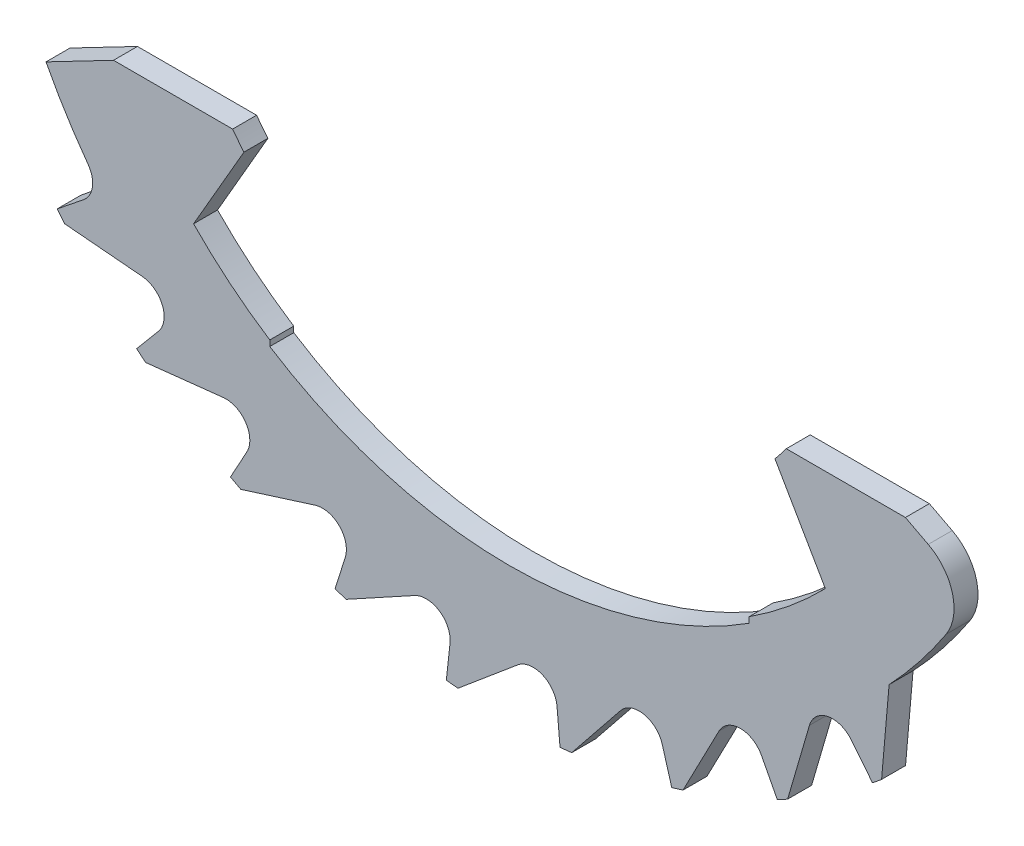
from build123d import *

# Parameters (mm, degrees)
OTHER_10076_5_DEPTH = 0.5
CUT_EXTRUDE1_REACH  = 18.147


# Read off the part's stored shape, not the designer's step: 10076-5
with BuildPart() as part:
    # Other 10076-5 outline → Other 10076-5 (new body)
    with BuildSketch(Plane.XY):
        with BuildLine():
            ThreePointArc((7.573674013, -9.436602245), (7.668819519, -9.359444812), (7.763179028, -9.281328104))
            Line((7.763179028, -9.281328104), (7.919995926, -7.488902759))
            ThreePointArc((7.919995926, -7.488902759), (8.548470738, -6.76266575), (9.110578105, -5.983925684))
            ThreePointArc((9.110578105, -5.983925684), (9.242448569, -5.182849851), (8.736493865, -4.547930843))
            Line((8.736493865, -4.547930843), (8.260223146, -4.3))
            Line((8.260223146, -4.3), (5.774945887, -4.3))
            ThreePointArc((5.774945887, -4.3), (5.659072475, -4.451392897), (5.53923133, -4.5996648))
            Line((5.53923133, -4.5996648), (6.59, -6.419649523))
            ThreePointArc((6.59, -6.419649523), (5.831509763, -7.1157216), (5, -7.722693831))
            Line((5, -7.722693831), (5, -7.841555968))
            ThreePointArc((5, -7.841555968), (0, -9.3), (-5, -7.841555968))
            Line((-5, -7.841555968), (-5, -7.722693831))
            ThreePointArc((-5, -7.722693831), (-5.831509763, -7.1157216), (-6.59, -6.419649523))
            Line((-6.59, -6.419649523), (-5.53923133, -4.5996648))
            ThreePointArc((-5.53923133, -4.5996648), (-5.659072475, -4.451392897), (-5.774945887, -4.3))
            Line((-5.774945887, -4.3), (-8.260223146, -4.3))
            Line((-8.260223146, -4.3), (-10.732831081, -5.58715822))
            ThreePointArc((-10.732831081, -5.58715822), (-10.675718173, -5.6955282), (-10.617511084, -5.803314431))
            Line((-10.617511084, -5.803314431), (-9.055174855, -6.258693914))
            ThreePointArc((-9.055174855, -6.258693914), (-8.704696722, -6.64117368), (-8.882127626, -7.128661083))
            Line((-8.882127626, -7.128661083), (-9.436602245, -7.573674013))
            ThreePointArc((-9.436602245, -7.573674013), (-9.359444812, -7.668819519), (-9.281328104, -7.763179028))
            Line((-9.281328104, -7.763179028), (-7.660171598, -7.905011844))
            ThreePointArc((-7.660171598, -7.905011844), (-7.241809703, -8.211767477), (-7.320727248, -8.724502998))
            Line((-7.320727248, -8.724502998), (-7.777730077, -9.269137762))
            ThreePointArc((-7.777730077, -9.269137762), (-7.683493234, -9.347402405), (-7.588468891, -9.424709008))
            Line((-7.588468891, -9.424709008), (-5.970792243, -9.247544602))
            ThreePointArc((-5.970792243, -9.247544602), (-5.500623999, -9.466787654), (-5.477995427, -9.985067155))
            Line((-5.477995427, -9.985067155), (-5.819964104, -10.608393744))
            ThreePointArc((-5.819964104, -10.608393744), (-5.712269322, -10.666769858), (-5.603989074, -10.724052707))
            Line((-5.603989074, -10.724052707), (-4.05195869, -10.234699407))
            ThreePointArc((-4.05195869, -10.234699407), (-3.548052399, -10.358004491), (-3.424747314, -10.861910782))
            Line((-3.424747314, -10.861910782), (-3.638540174, -11.539975104))
            ThreePointArc((-3.638540174, -11.539975104), (-3.521526102, -11.576219327), (-3.404151099, -11.611277074))
            Line((-3.404151099, -11.611277074), (-1.977410637, -10.828540453))
            ThreePointArc((-1.977410637, -10.828540453), (-1.459131136, -10.851169025), (-1.239888083, -11.321337268))
            Line((-1.239888083, -11.321337268), (-1.317289186, -12.028081692))
            ThreePointArc((-1.317289186, -12.028081692), (-1.195452609, -12.04080118), (-1.073493507, -12.052286575))
            Line((-1.073493507, -12.052286575), (0.173128198, -11.006246762))
            ThreePointArc((0.173128198, -11.006246762), (0.685863719, -10.927329218), (0.992619352, -11.345691113))
            Line((0.992619352, -11.345691113), (1.054584487, -12.053955847))
            ThreePointArc((1.054584487, -12.053955847), (1.176561457, -12.042661796), (1.298417839, -12.030133462))
            Line((1.298417839, -12.030133462), (2.317013814, -10.760989181))
            ThreePointArc((2.317013814, -10.760989181), (2.804501216, -10.583558277), (3.186980982, -10.93403641))
            Line((3.186980982, -10.93403641), (3.38593107, -11.616603238))
            ThreePointArc((3.38593107, -11.616603238), (3.503360927, -11.581729673), (3.620431715, -11.545669067))
            Line((3.620431715, -11.545669067), (4.371857887, -10.10219282))
            ThreePointArc((4.371857887, -10.10219282), (4.815363304, -9.833067127), (5.258868721, -10.10219282))
            Line((5.258868721, -10.10219282), (5.58715822, -10.732831081))
            ThreePointArc((5.58715822, -10.732831081), (5.6955282, -10.675718173), (5.803314431, -10.617511084))
            Line((5.803314431, -10.617511084), (6.258693914, -9.055174855))
            ThreePointArc((6.258693914, -9.055174855), (6.64117368, -8.704696722), (7.128661083, -8.882127626))
            Line((7.128661083, -8.882127626), (7.573674013, -9.436602245))
        make_face()
    extrude(amount=OTHER_10076_5_DEPTH)

    # Sketch1 → Cut-Extrude1 (cut, up to next)
    with BuildSketch(Plane.XY.offset(0.5), mode=Mode.PRIVATE) as cut_extrude1_sk1:
        with BuildLine():
            Line((-9.668418082, -5.033059884), (-10.732831081, -5.58715822))
            ThreePointArc((-10.732831081, -5.58715822), (-10.675718173, -5.6955282), (-10.617511084, -5.803314431))
            Line((-10.617511084, -5.803314431), (-9.055174855, -6.258693914))
            ThreePointArc((-9.055174855, -6.258693914), (-8.908251896, -6.329177308), (-8.791795969, -6.443160998))
            ThreePointArc((-8.791795969, -6.443160998), (-9.25699584, -5.754826497), (-9.668418082, -5.033059884))
        make_face()
    cut_extrude1_tool1 = extrude(cut_extrude1_sk1.sketch, amount=-CUT_EXTRUDE1_REACH, mode=Mode.PRIVATE) & part.part
    add(cut_extrude1_tool1.solids().sort_by_distance((-9.821515, -5.682947, 0.5))[0], mode=Mode.SUBTRACT)


solid = part.part
